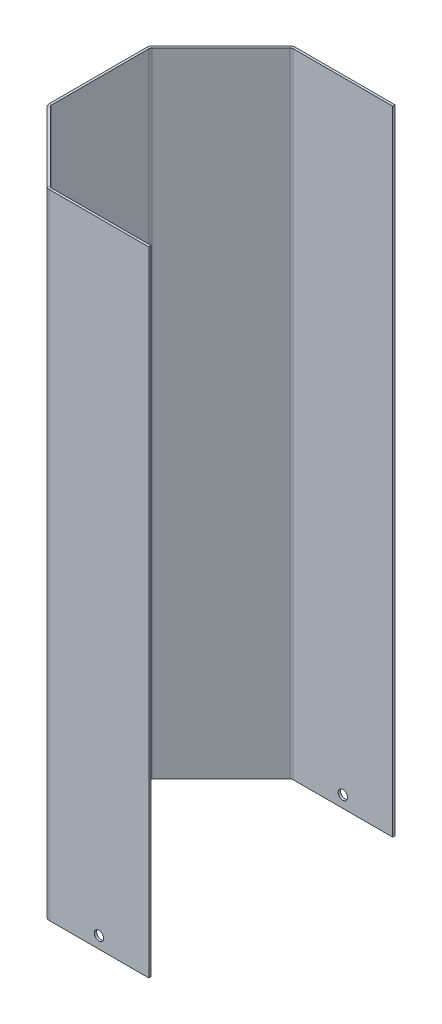
from build123d import *

# Parameters (mm, degrees)
SM_BASE_FLANGE_1_DEPTH = 270
SKETCH_2_R             = 2
CUT_EXTRUDE_1_DEPTH    = 130
SKETCH_3_R             = 2
CUT_EXTRUDE_2_DEPTH    = 130


# Sheet-metal steps are written as plain solids
with BuildPart() as part:
    # Sketch 1 → Базовая кромка1 (new body)
    with BuildSketch(Plane(origin=(0, 0, 0), x_dir=(1, 0, 0), z_dir=(0, 1, 0))):
        with BuildLine():
            Line((-177.353282485, 51.5), (-219.85622621, 51.5))
            ThreePointArc((-219.85622621, 51.5), (-220.315446329, 51.408655439), (-220.704754348, 51.148528137))
            Line((-220.704754348, 51.148528137), (-250.16981216, 21.683470325))
            ThreePointArc((-250.16981216, 21.683470325), (-250.429939462, 21.294162306), (-250.521284023, 20.834942187))
            Line((-250.521284023, 20.834942187), (-250.521284023, -20.834942187))
            ThreePointArc((-250.521284023, -20.834942187), (-250.429939462, -21.294162306), (-250.16981216, -21.683470325))
            Line((-250.16981216, -21.683470325), (-220.704754348, -51.148528137))
            ThreePointArc((-220.704754348, -51.148528137), (-220.315446329, -51.408655439), (-219.85622621, -51.5))
            Line((-219.85622621, -51.5), (-177.353282485, -51.5))
            Line((-177.353282485, -51.5), (-177.353282485, -52.5))
            Line((-177.353282485, -52.5), (-219.85622621, -52.5))
            ThreePointArc((-219.85622621, -52.5), (-220.698129761, -52.332534972), (-221.411861129, -51.855634919))
            Line((-221.411861129, -51.855634919), (-250.876918941, -22.390577106))
            ThreePointArc((-250.876918941, -22.390577106), (-251.353818994, -21.676845739), (-251.521284023, -20.834942187))
            Line((-251.521284023, -20.834942187), (-251.521284023, 20.834942187))
            ThreePointArc((-251.521284023, 20.834942187), (-251.353818994, 21.676845739), (-250.876918941, 22.390577106))
            Line((-250.876918941, 22.390577106), (-221.411861129, 51.855634919))
            ThreePointArc((-221.411861129, 51.855634919), (-220.698129761, 52.332534972), (-219.85622621, 52.5))
            Line((-219.85622621, 52.5), (-177.353282485, 52.5))
            Line((-177.353282485, 52.5), (-177.353282485, 51.5))
        make_face()
    extrude(amount=SM_BASE_FLANGE_1_DEPTH)

    # Эскиз2 → Вырез-Вытянуть1 (cut)
    with BuildSketch(Plane.XY.offset(52.5)):
        with Locations((-198.604754348, 5)):
            Circle(SKETCH_2_R)
    extrude(amount=-CUT_EXTRUDE_1_DEPTH, mode=Mode.SUBTRACT)

    # Эскиз3 → Вырез-Вытянуть2 (cut)
    with BuildSketch(Plane.ZY.offset(251.521284023)):
        with Locations((0, 5)):
            Circle(SKETCH_3_R)
    extrude(amount=-CUT_EXTRUDE_2_DEPTH, mode=Mode.SUBTRACT)


solid = part.part
